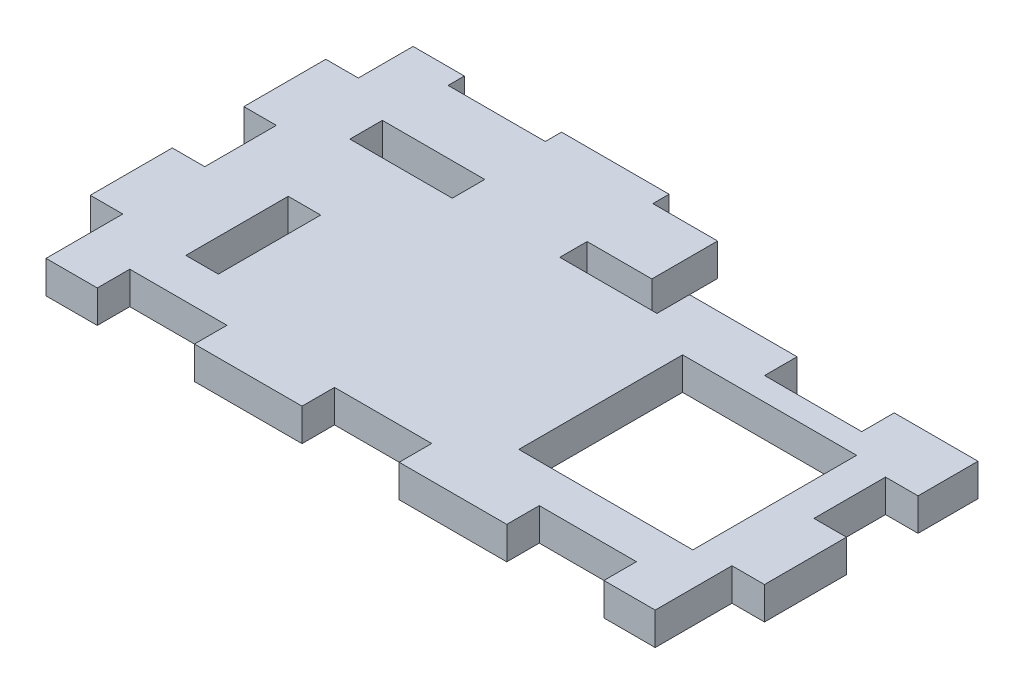
from build123d import *

# Parameters (mm, degrees)
BOTTOM_START                  = -0.928285838
BOTTOM_SIDE_PIECE_OUTLINE_W   = 3.175
BOTTOM_SIDE_PIECE_OUTLINE_H   = 10
BOTTOM_SIDE_PIECE_OUTLINE_W_2 = 10
BOTTOM_SIDE_PIECE_OUTLINE_H_2 = 3.175
BOTTOM_SIDE_PIECE_DEPTH       = 3.175
SKETCH6_W                     = 17
SKETCH6_H                     = 16
CUT_EXTRUDE2_DEPTH            = 77.155702908


# Read off the part's stored shape, not the designer's step: Bottom Side Piece
with BuildPart() as part:
    # Bottom Side Piece outline → Bottom Side Piece (new body)
    with BuildSketch(Plane(origin=(0, 0, 0), x_dir=(1, 0, 0), z_dir=(0, 1, 0)).offset(BOTTOM_START)):
        Polygon((2.240974339, 5.585190103), (5.415974339, 5.585190103), (5.415974339, -1.914809897), (10.423974339, -1.914809897), (10.423974339, 1.260190103), (19.915974339, 1.260190103), (19.915974339, -1.914809897), (30.423974339, -1.914809897), (30.423974339, 1.260190103), (39.915974339, 1.260190103), (39.915974339, -1.914809897), (50.423974339, -1.914809897), (50.423974339, 1.260190103), (59.915974339, 1.260190103), (59.915974339, -1.914809897), (64.923974339, -1.914809897), (64.923974339, 5.585190103), (68.098974339, 5.585190103), (68.098974339, 13.593190103), (64.923974339, 13.593190103), (64.923974339, 20.585190103), (68.098974339, 20.585190103), (68.098974339, 26.443190103), (59.915974339, 26.443190103), (59.915974339, 23.268190103), (50.423974339, 23.268190103), (50.423974339, 26.443190103), (39.915974339, 26.443190103), (39.915974339, 23.268190103), (30.423974339, 23.268190103), (30.423974339, 25.935190103), (36.748974339, 25.935190103), (36.748974339, 32.355690103), (30.423974339, 32.355690103), (30.423974339, 33.943190103), (19.915974339, 33.943190103), (19.915974339, 32.355690103), (10.423974339, 32.355690103), (10.423974339, 33.943190103), (5.415974339, 33.943190103), (5.415974339, 28.593190103), (2.240974339, 28.593190103), (2.240974339, 20.585190103), (5.415974339, 20.585190103), (5.415974339, 13.593190103), (2.240974339, 13.593190103), align=None)
        with Locations((13.582474339, 10.164190103)):
            Rectangle(BOTTOM_SIDE_PIECE_OUTLINE_W, BOTTOM_SIDE_PIECE_OUTLINE_H, mode=Mode.SUBTRACT)
        with Locations((56.757474339, 10.164190103)):
            Rectangle(BOTTOM_SIDE_PIECE_OUTLINE_W, BOTTOM_SIDE_PIECE_OUTLINE_H, mode=Mode.SUBTRACT)
        with Locations((15.169974339, 24.601690103)):
            Rectangle(BOTTOM_SIDE_PIECE_OUTLINE_W_2, BOTTOM_SIDE_PIECE_OUTLINE_H_2, mode=Mode.SUBTRACT)
    extrude(amount=BOTTOM_SIDE_PIECE_DEPTH)

    # Sketch6 → Cut-Extrude2 (cut, through all)
    with BuildSketch(Plane(origin=(0, 2.246714162, 0), x_dir=(1, 0, 0), z_dir=(0, 1, 0))):
        with Locations((53.169974339, 13.014190103)):
            Rectangle(SKETCH6_W, SKETCH6_H)
    extrude(amount=-CUT_EXTRUDE2_DEPTH, mode=Mode.SUBTRACT)


solid = part.part
